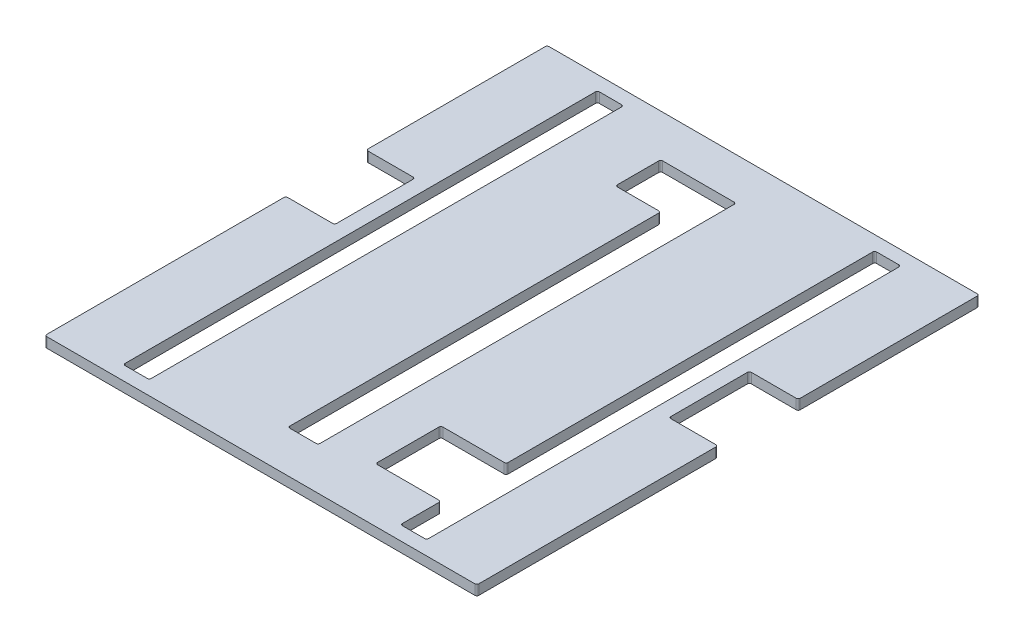
from build123d import *

# Parameters (mm, degrees)
SKETCH1_W           = 430
SKETCH1_H           = 500
BOSS_EXTRUDE1_DEPTH = 10
SKETCH2_W           = 48.6
SKETCH2_H           = 80
CUT_EXTRUDE1_DEPTH  = 10
SKETCH3_W           = 26
SKETCH3_H           = 472
CUT_EXTRUDE2_DEPTH  = 10
SKETCH4_W           = 65
SKETCH4_H           = 65
CUT_EXTRUDE3_DEPTH  = 10
FILLET2_R           = 2
FILLET3_R           = 2


with BuildPart() as part:
    # Sketch1 → Boss-Extrude1 (new body)
    with BuildSketch(Plane(origin=(0, 0, 0), x_dir=(1, 0, 0), z_dir=(0, 1, 0))):
        with Locations((6126.084066999, -8702.312377786)):
            Rectangle(SKETCH1_W, SKETCH1_H)
    extrude(amount=BOSS_EXTRUDE1_DEPTH)

    # Sketch2 → Cut-Extrude1 (cut)
    with BuildSketch(Plane(origin=(0, 10, 0), x_dir=(1, 0, 0), z_dir=(0, 1, 0))):
        with Locations((5935.384066999, -8672.447976714)):
            Rectangle(SKETCH2_W, SKETCH2_H)
        with Locations((6316.784066999, -8672.447976714)):
            Rectangle(SKETCH2_W, SKETCH2_H)
    extrude(amount=-CUT_EXTRUDE1_DEPTH, mode=Mode.SUBTRACT)

    # Sketch3 → Cut-Extrude2 (cut)
    with BuildSketch(Plane(origin=(0, 10, 0), x_dir=(1, 0, 0), z_dir=(0, 1, 0))):
        Polygon((5975.084066999, -8541.651929061), (5975.084066999, -8938.312377786), (6001.084066999, -8938.312377786), (6001.084066999, -8466.312377786), (5975.084066999, -8466.312377786), align=None)
        with Locations((6264.084066999, -8702.312377786)):
            Rectangle(SKETCH3_W, SKETCH3_H)
        Polygon((6111.084066999, -8494.312377786), (6141.084066999, -8494.312377786), (6141.084066999, -8910.312377786), (6111.084066999, -8910.312377786), (6111.084066999, -8539.312377786), (6066.084066999, -8539.312377786), (6066.084066999, -8494.312377786), align=None)
    extrude(amount=-CUT_EXTRUDE2_DEPTH, mode=Mode.SUBTRACT)

    # Sketch4 → Cut-Extrude3 (cut)
    with BuildSketch(Plane(origin=(0, 10, 0), x_dir=(1, 0, 0), z_dir=(0, 1, 0))):
        with Locations((6218.584066999, -8865.596518708)):
            Rectangle(SKETCH4_W, SKETCH4_H)
    extrude(amount=-CUT_EXTRUDE3_DEPTH, mode=Mode.SUBTRACT)

    # Fillet2
    fillet2_edges = [part.edges().sort_by_distance(p)[0] for p in [
        (6292.484066999, 5, 8632.447976714),
        (6341.084066999, 5, 8632.447976714),
        (6341.084066999, 5, 8712.447976714),
        (6292.484066999, 5, 8712.447976714),
        (5959.684066999, 5, 8632.447976714),
        (5959.684066999, 5, 8712.447976714),
        (5911.084066999, 5, 8712.447976714),
        (5911.084066999, 5, 8632.447976714),
        (5911.084066999, 5, 8452.312377786),
        (6341.084066999, 5, 8452.312377786),
        (6341.084066999, 5, 8952.312377786),
        (5911.084066999, 5, 8952.312377786),
    ]]
    fillet(fillet2_edges, radius=FILLET2_R)

    # Fillet3
    fillet3_edges = [part.edges().sort_by_distance(p)[0] for p in [
        (6001.084066999, 5, 8938.312377786),
        (5975.084066999, 5, 8938.312377786),
        (6001.084066999, 5, 8466.312377786),
        (5975.084066999, 5, 8466.312377786),
        (6277.084066999, 5, 8938.312377786),
        (6251.084066999, 5, 8938.312377786),
        (6277.084066999, 5, 8466.312377786),
        (6251.084066999, 5, 8466.312377786),
        (6141.084066999, 5, 8910.312377786),
        (6111.084066999, 5, 8910.312377786),
        (6141.084066999, 5, 8494.312377786),
        (6111.084066999, 5, 8539.312377786),
        (6066.084066999, 5, 8494.312377786),
        (6066.084066999, 5, 8539.312377786),
        (6251.084066999, 5, 8898.096518708),
        (6251.084066999, 5, 8833.096518708),
        (6186.084066999, 5, 8833.096518708),
        (6186.084066999, 5, 8898.096518708),
    ]]
    fillet(fillet3_edges, radius=FILLET3_R)


solid = part.part
